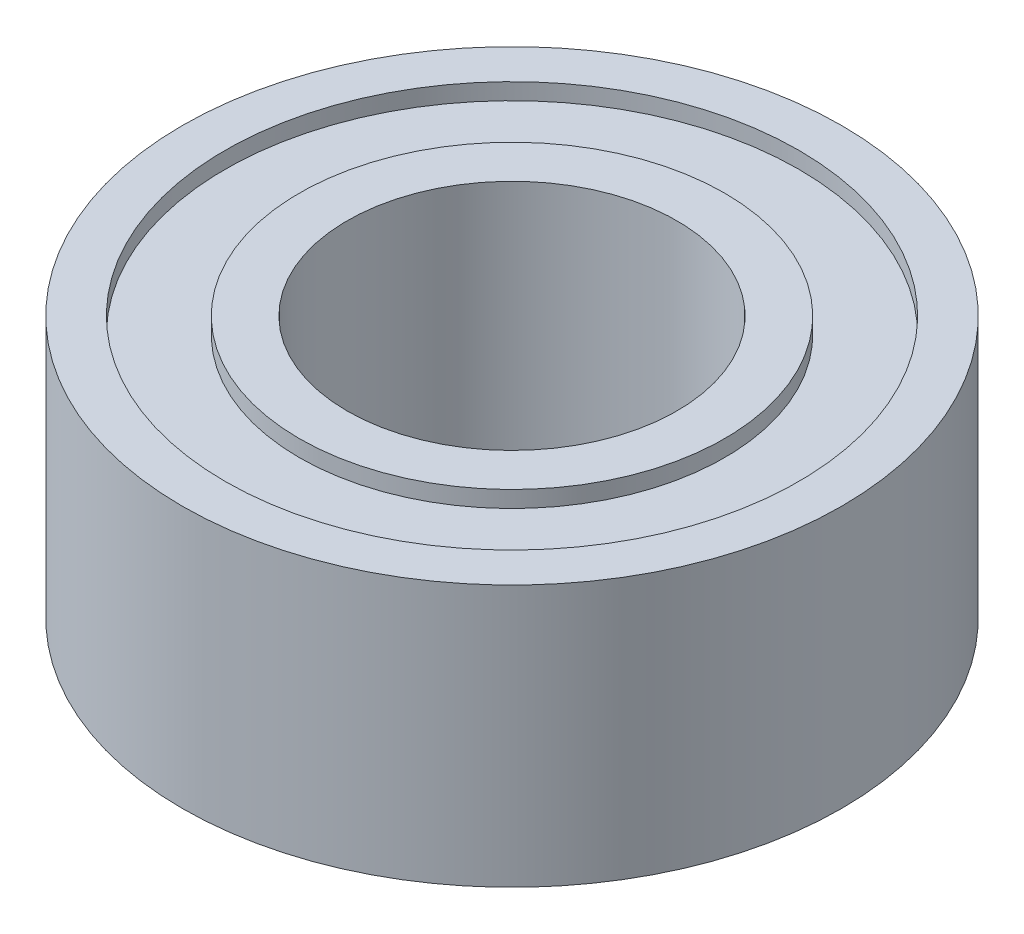
from build123d import *

# Parameters (mm, degrees)
SKETCH1_R           = 5
SKETCH1_R_2         = 2.5
BOSS_EXTRUDE1_DEPTH = 3.97
SKETCH2_R           = 4.35
SKETCH2_R_2         = 3.225
CUT_EXTRUDE1_DEPTH  = 0.25
CUT_EXTRUDE2_START  = -0.25
SKETCH3_R           = 4.35
SKETCH3_R_2         = 3.225
CUT_EXTRUDE2_DEPTH  = 0.25


with BuildPart() as part:
    # Sketch1 → Boss-Extrude1 (new body)
    with BuildSketch(Plane(origin=(0, 0, 0), x_dir=(1, 0, 0), z_dir=(0, 1, 0))):
        Circle(SKETCH1_R)
        Circle(SKETCH1_R_2, mode=Mode.SUBTRACT)
    extrude(amount=BOSS_EXTRUDE1_DEPTH)

    # Sketch2 → Cut-Extrude1 (cut)
    with BuildSketch(Plane(origin=(0, 3.97, 0), x_dir=(1, 0, 0), z_dir=(0, 1, 0))):
        Circle(SKETCH2_R)
        Circle(SKETCH2_R_2, mode=Mode.SUBTRACT)
    extrude(amount=-CUT_EXTRUDE1_DEPTH, mode=Mode.SUBTRACT)

    # Sketch3 → Cut-Extrude2 (cut)
    with BuildSketch(Plane.XZ.offset(CUT_EXTRUDE2_START)):
        Circle(SKETCH3_R)
        Circle(SKETCH3_R_2, mode=Mode.SUBTRACT)
    extrude(amount=CUT_EXTRUDE2_DEPTH, mode=Mode.SUBTRACT)


solid = part.part
